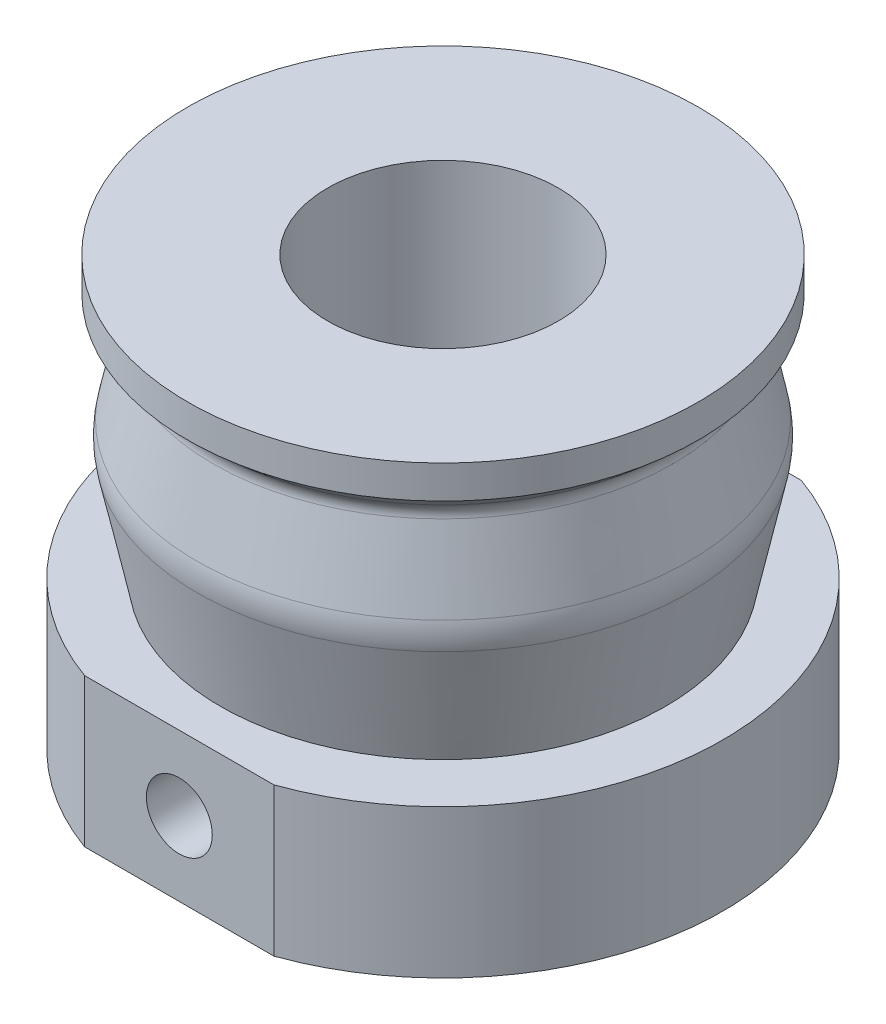
from build123d import *

# Parameters (mm, degrees)
CUT_EXTRUDE1_DEPTH = 4.5
CHAMFER1_SIZE      = 1
CHAMFER1_SIZE_2    = 0.75
FILLET2_R          = 0.5


with BuildPart() as part:
    # Sketch2 → Revolve1 (revolve)
    with BuildSketch(Plane.XY, mode=Mode.PRIVATE) as revolve1_sk:
        with BuildLine():
            Line((3.5, 0), (3.5, 13))
            Line((3.5, 13), (7.75, 13))
            Line((7.75, 13), (7.75, 12))
            Line((7.75, 12), (6.75, 12))
            Line((6.75, 12), (7.456581804, 8.664472732))
            ThreePointArc((7.456581804, 8.664472732), (7.5, 8.25), (7.456581804, 7.835527268))
            Line((7.456581804, 7.835527268), (6.75, 4.5))
            Line((6.75, 4.5), (8.5, 4.5))
            Line((8.5, 4.5), (8.5, 0))
            Line((8.5, 0), (3.5, 0))
        make_face()
    revolve(revolve1_sk.sketch.rotate(Axis((0, 0, 0), (0, 1, 0)), 90), axis=Axis((0, 0, 0), (0, 1, 0)))

    # Sketch3 → Cut-Extrude1 (cut)
    with BuildSketch(Plane.XZ):
        with BuildLine():
            Line((-2.872281323, 8), (2.872281323, 8))
            ThreePointArc((2.872281323, 8), (0, 8.5), (-2.872281323, 8))
        make_face()
    cut_extrude1 = extrude(amount=-CUT_EXTRUDE1_DEPTH, mode=Mode.SUBTRACT)

    # Sketch5 → Ø2.0mm Dowel Hole1 (revolve, cut)
    with BuildSketch(Plane(origin=(0, 2.25, 8), x_dir=(0, -1, 0), z_dir=(1, 0, 0))):
        Polygon((0, 0), (0, 6.600860619), (1, 6), (1, 0), align=None)
    f_2_0mm_dowel_hole1 = revolve(axis=Axis((0, 2.25, 14.35), (0, 0, -1)), mode=Mode.SUBTRACT)

    # Mirror1: Cut-Extrude1, Ø2.0mm Dowel Hole1 across plane
    add(cut_extrude1.mirror(Plane.XY), mode=Mode.SUBTRACT)
    add(f_2_0mm_dowel_hole1.mirror(Plane.XY), mode=Mode.SUBTRACT)

    # Chamfer1
    # the kernel refuses this chamfer: 1, 0.75 mm, written as the material it adds along each edge
    with BuildSketch(Plane(origin=(0, 12, 0), x_dir=(0, 0, -1), z_dir=(1, 0, 0))) as chamfer1_piece_1:
        Polygon((6.75 + CHAMFER1_SIZE, 0), (6.75 + CHAMFER1_SIZE_2 * 0.20723636606, -CHAMFER1_SIZE_2 * 0.978290901819), (6.75, 0), align=None)
    revolve(axis=Axis((0, 12, 0), (0, 1, 0)))

    # Fillet2
    fillet2_edges = [part.edges().sort_by_distance(p)[0] for p in [
        (0, 11.266281824, 6.905427275),
    ]]
    fillet(fillet2_edges, radius=FILLET2_R)


solid = part.part
